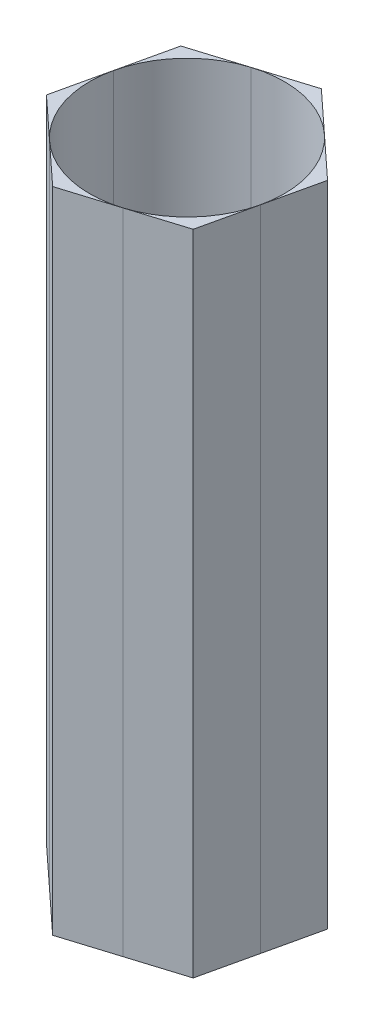
from build123d import *

# Parameters (mm, degrees)
BOSS_EXTRUDE1_DEPTH  = 10
CUT_EXTRUDE1_START   = -10
CUT_EXTRUDE1_DEPTH   = 10
CUT_EXTRUDE1_2_DEPTH = 10
CUT_EXTRUDE1_3_DEPTH = 10
CUT_EXTRUDE1_4_DEPTH = 10
CUT_EXTRUDE1_5_DEPTH = 10
CUT_EXTRUDE1_6_DEPTH = 10


# Read off the part's stored shape, not the designer's step: Cut-Extrude1
with BuildPart() as part:
    # Sketch1 → Boss-Extrude1 (new body)
    with BuildSketch(Plane(origin=(0, 0, 0), x_dir=(1, 0, 0), z_dir=(0, 1, 0))):
        Polygon((1.271576911, -1.176049387), (1.6542771, 0.513193214), (0.38270019, 1.689242601), (-1.271576911, 1.176049387), (-1.6542771, -0.513193214), (-0.38270019, -1.689242601), align=None)
    extrude(amount=BOSS_EXTRUDE1_DEPTH)

    # Cut-Extrude1 6 outline → Cut-Extrude1 6 (cut)
    with BuildSketch(Plane(origin=(0, 10, 0), x_dir=(1, 0, 0), z_dir=(0, 1, 0)).offset(CUT_EXTRUDE1_START)):
        with BuildLine():
            Line((1.271576911, -1.176049387), (1.462929782, -0.331428716))
            ThreePointArc((1.462929782, -0.331428716), (1.432648713, 0.444439204), (1.018490579, 1.101219998))
            Line((1.018490579, 1.101219998), (0.38270019, 1.689242601))
            Line((0.38270019, 1.689242601), (-1.271576911, 1.176049387))
            Line((-1.271576911, 1.176049387), (-1.6542771, -0.513193214))
            Line((-1.6542771, -0.513193214), (-0.38270019, -1.689242601))
            Line((-0.38270019, -1.689242601), (1.271576911, -1.176049387))
        make_face()
    extrude(amount=CUT_EXTRUDE1_6_DEPTH, mode=Mode.SUBTRACT)


with BuildPart() as body_2:
    # Cut-Extrude1 outline → Cut-Extrude1 (new body)
    with BuildSketch(Plane(origin=(0, 10, 0), x_dir=(1, 0, 0), z_dir=(0, 1, 0)).offset(CUT_EXTRUDE1_START)):
        with BuildLine():
            Line((0.444439204, -1.432648713), (1.271576911, -1.176049387))
            Line((1.271576911, -1.176049387), (1.462929782, -0.331428716))
            ThreePointArc((1.462929782, -0.331428716), (1.101219998, -1.018490579), (0.444439204, -1.432648713))
        make_face()
    extrude(amount=CUT_EXTRUDE1_DEPTH)


with BuildPart() as body_3:
    # Cut-Extrude1 2 outline → Cut-Extrude1 2 (new body)
    with BuildSketch(Plane(origin=(0, 10, 0), x_dir=(1, 0, 0), z_dir=(0, 1, 0)).offset(CUT_EXTRUDE1_START)):
        with BuildLine():
            Line((-1.018490579, -1.101219998), (-0.38270019, -1.689242601))
            Line((-0.38270019, -1.689242601), (0.444439204, -1.432648713))
            ThreePointArc((0.444439204, -1.432648713), (-0.331428716, -1.462929782), (-1.018490579, -1.101219998))
        make_face()
    extrude(amount=CUT_EXTRUDE1_2_DEPTH)


with BuildPart() as body_4:
    # Cut-Extrude1 3 outline → Cut-Extrude1 3 (new body)
    with BuildSketch(Plane(origin=(0, 10, 0), x_dir=(1, 0, 0), z_dir=(0, 1, 0)).offset(CUT_EXTRUDE1_START)):
        with BuildLine():
            Line((-1.6542771, -0.513193214), (-1.018490579, -1.101219998))
            ThreePointArc((-1.018490579, -1.101219998), (-1.432648713, -0.444439204), (-1.462929782, 0.331428716))
            Line((-1.462929782, 0.331428716), (-1.6542771, -0.513193214))
        make_face()
    extrude(amount=CUT_EXTRUDE1_3_DEPTH)


with BuildPart() as body_5:
    # Cut-Extrude1 4 outline → Cut-Extrude1 4 (new body)
    with BuildSketch(Plane(origin=(0, 10, 0), x_dir=(1, 0, 0), z_dir=(0, 1, 0)).offset(CUT_EXTRUDE1_START)):
        with BuildLine():
            Line((-1.271576911, 1.176049387), (-1.462929782, 0.331428716))
            ThreePointArc((-1.462929782, 0.331428716), (-1.101219998, 1.018490579), (-0.444439204, 1.432648713))
            Line((-0.444439204, 1.432648713), (-1.271576911, 1.176049387))
        make_face()
    extrude(amount=CUT_EXTRUDE1_4_DEPTH)


with BuildPart() as body_6:
    # Cut-Extrude1 5 outline → Cut-Extrude1 5 (new body)
    with BuildSketch(Plane(origin=(0, 10, 0), x_dir=(1, 0, 0), z_dir=(0, 1, 0)).offset(CUT_EXTRUDE1_START)):
        with BuildLine():
            Line((0.38270019, 1.689242601), (-0.444439204, 1.432648713))
            ThreePointArc((-0.444439204, 1.432648713), (0.331428716, 1.462929782), (1.018490579, 1.101219998))
            Line((1.018490579, 1.101219998), (0.38270019, 1.689242601))
        make_face()
    extrude(amount=CUT_EXTRUDE1_5_DEPTH)


solid = Compound([part.part, body_2.part, body_3.part, body_4.part, body_5.part, body_6.part])
